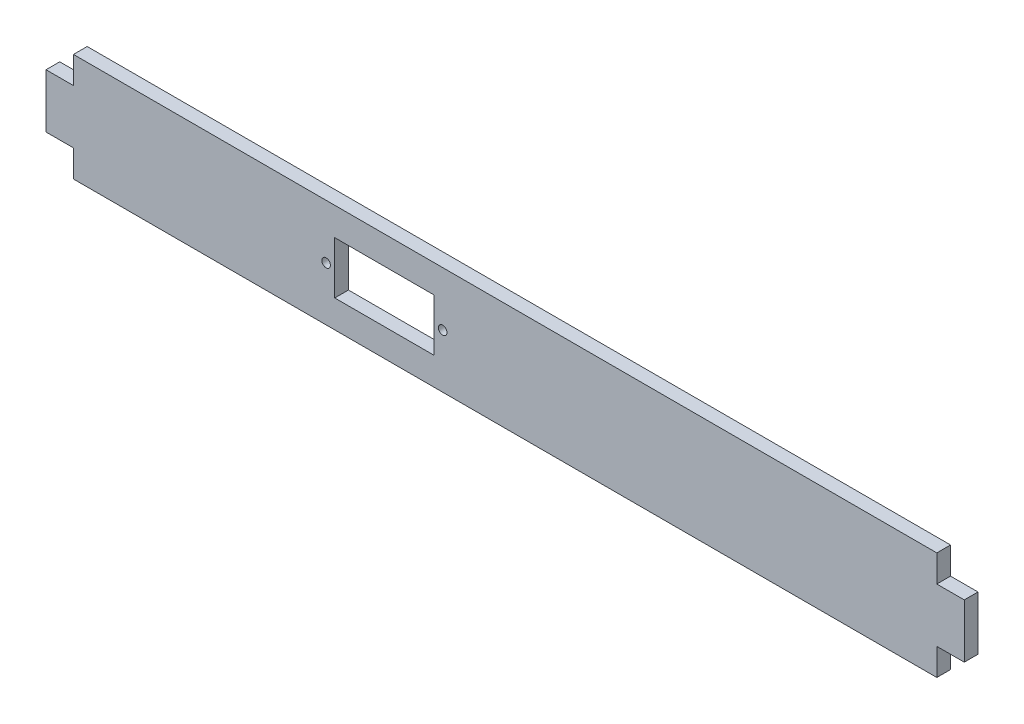
from build123d import *

# Parameters (mm, degrees)
SKETCH2_W           = 200
SKETCH2_H           = 25
BOSS_EXTRUDE1_DEPTH = 1.59
SKETCH4_R           = 1
SKETCH4_W           = 23
SKETCH4_H           = 12.1
CUT_EXTRUDE1_DEPTH  = 3.18
SKETCH5_W           = 6.36
SKETCH5_H           = 12.5
BOSS_EXTRUDE2_DEPTH = 3.18


with BuildPart() as part:
    # Sketch2 → Boss-Extrude1 (new, symmetric)
    with BuildSketch(Plane.XY):
        with Locations((100, 12.5)):
            Rectangle(SKETCH2_W, SKETCH2_H)
    extrude(amount=BOSS_EXTRUDE1_DEPTH, both=True)

    # Sketch4 → Cut-Extrude1 (cut)
    with BuildSketch(Plane(origin=(0, 0, -1.59), x_dir=(-1, 0, 0), z_dir=(0, 0, -1))):
        with Locations((-85.527802634, 12.457546073)):
            Circle(SKETCH4_R)
        with Locations((-58.527802634, 12.457546073)):
            Circle(SKETCH4_R)
        with Locations((-72.027802634, 12.457546073)):
            Rectangle(SKETCH4_W, SKETCH4_H)
    extrude(amount=-CUT_EXTRUDE1_DEPTH, mode=Mode.SUBTRACT)

    # Sketch5 → Boss-Extrude2 (add)
    with BuildSketch(Plane(origin=(0, 0, -1.59), x_dir=(-1, 0, 0), z_dir=(0, 0, -1))):
        with Locations((-203.18, 12.5)):
            Rectangle(SKETCH5_W, SKETCH5_H)
        with Locations((3.18, 12.5)):
            Rectangle(SKETCH5_W, SKETCH5_H)
    extrude(amount=-BOSS_EXTRUDE2_DEPTH)


solid = part.part
